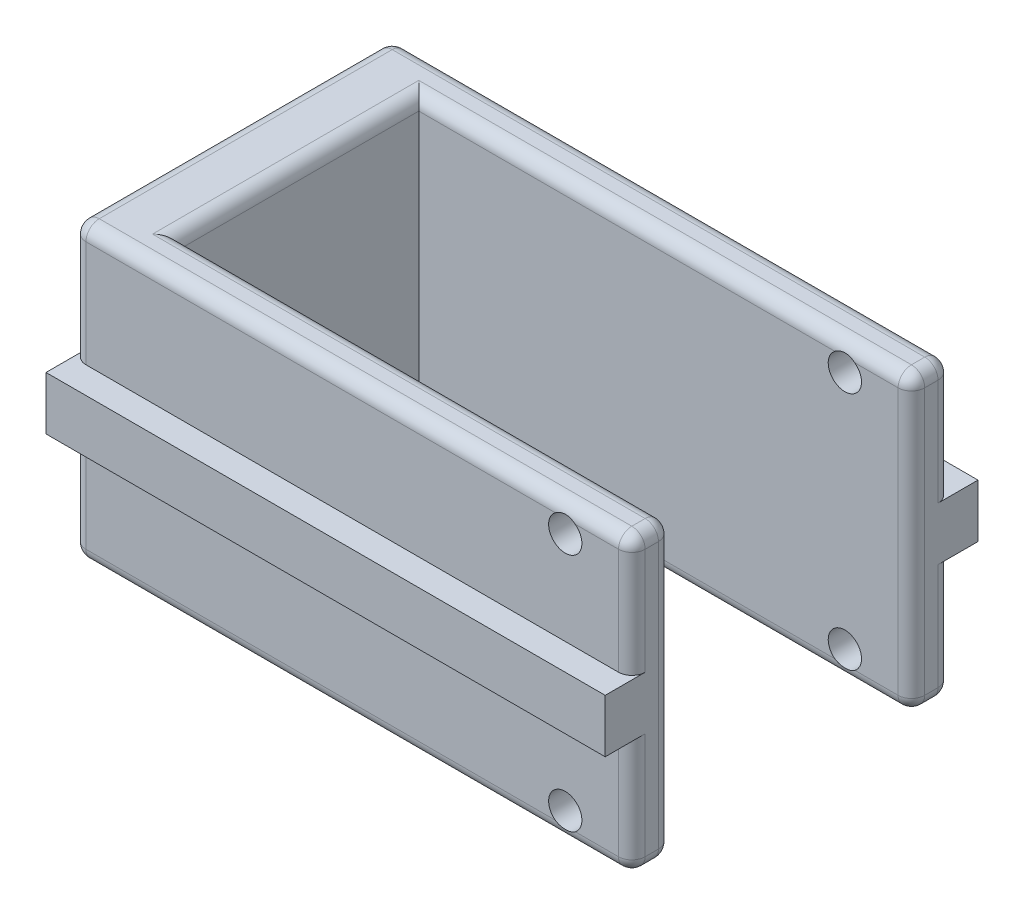
from build123d import *

# Parameters (mm, degrees)
BOSS_EXTRUDE1_DEPTH = 22
SKETCH2_R           = 1.25
CUT_EXTRUDE1_DEPTH  = 54.141321022
SKETCH3_R           = 2.5
BOSS_EXTRUDE2_DEPTH = 5
FILLET1_R           = 1
SKETCH4_W           = 4
SKETCH4_H           = 4
BOSS_EXTRUDE3_DEPTH = 42
FILLET2_R           = 1
FILLET3_R           = 1
FILLET4_R           = 1
FILLET5_R           = 1


with BuildPart() as part:
    # Sketch1 → Boss-Extrude1 (new body)
    with BuildSketch(Plane(origin=(0, 0, 0), x_dir=(1, 0, 0), z_dir=(0, 1, 0))):
        Polygon((0, 0), (-42, 0), (-42, 24), (0, 24), (0, 21), (-37, 21), (-37, 3), (0, 3), align=None)
    extrude(amount=BOSS_EXTRUDE1_DEPTH)

    # Sketch2 → Cut-Extrude1 (cut, through all)
    with BuildSketch(Plane.XY):
        with Locations((-5, 20)):
            Circle(SKETCH2_R)
        with Locations((-5, 2)):
            Circle(SKETCH2_R)
    extrude(amount=-CUT_EXTRUDE1_DEPTH, mode=Mode.SUBTRACT)

    # Sketch3 → Boss-Extrude2 (add)
    with BuildSketch(Plane.ZY.offset(42)):
        with Locations((-12, 11)):
            Circle(SKETCH3_R)
    extrude(amount=BOSS_EXTRUDE2_DEPTH)

    # Fillet1
    fillet1_edges = [part.edges().sort_by_distance(p)[0] for p in [
        (-42, 11, -14.5),
    ]]
    fillet(fillet1_edges, radius=FILLET1_R)

    # Sketch4 → Boss-Extrude3 (add)
    with BuildSketch(Plane.ZY.offset(42)):
        with Locations((-24, 11)):
            Rectangle(SKETCH4_W, SKETCH4_H)
        with Locations((0, 11)):
            Rectangle(SKETCH4_W, SKETCH4_H)
    extrude(amount=-BOSS_EXTRUDE3_DEPTH)

    # Fillet2
    fillet2_edges = [part.edges().sort_by_distance(p)[0] for p in [
        (-42, 22, -12),
        (-42, 0, -12),
    ]]
    fillet(fillet2_edges, radius=FILLET2_R)

    # Fillet3
    # the kernel refuses this fillet: 1 mm, written as the material it takes off along each edge
    with BuildSketch(Plane(origin=(-37, 22, -21), x_dir=(-1, 0, 0), z_dir=(0, 0, 1))) as fillet3_piece_1:
        with BuildLine():
            CenterArc((FILLET3_R, FILLET3_R), FILLET3_R, 180, 90)
            Line((0, FILLET3_R), (0, 0))
            Line((0, 0), (FILLET3_R, 0))
        make_face()
    extrude(amount=18, mode=Mode.SUBTRACT)
    with BuildSketch(Plane(origin=(2.5, 22, -21), x_dir=(0, 0, -1), z_dir=(-1, 0, 0)), Plane(origin=(-37, 22, -3), x_dir=(0, 0, 1), z_dir=(1, 0, 0))) as fillet3_piece_2:
        with BuildLine():
            CenterArc((FILLET3_R, FILLET3_R), FILLET3_R, 180, 90)
            Line((0, FILLET3_R), (0, 0))
            Line((0, 0), (FILLET3_R, 0))
        make_face()
    extrude(amount=39.5, mode=Mode.SUBTRACT)
    with BuildSketch(Plane(origin=(0, 22, -26.5), x_dir=(0, -1, 0), z_dir=(0, 0, 1)), Plane(origin=(0, 22, -5.5), x_dir=(0, -1, 0), z_dir=(0, 0, 1)), Plane(origin=(-42, 13, 0), x_dir=(0, 0, -1), z_dir=(0, 1, 0))) as fillet3_piece_3:
        with BuildLine():
            CenterArc((FILLET3_R, -FILLET3_R), FILLET3_R, 90, 90)
            Line((0, -FILLET3_R), (0, 0))
            Line((0, 0), (FILLET3_R, 0))
        make_face()
    extrude(amount=8, mode=Mode.SUBTRACT)
    with BuildSketch(Plane(origin=(-41, 22, -24), x_dir=(0, -1, 0), z_dir=(1, 0, 0)), Plane(origin=(2.5, 22, 0), x_dir=(0, -1, 0), z_dir=(-1, 0, 0))) as fillet3_piece_4:
        with BuildLine():
            CenterArc((FILLET3_R, -FILLET3_R), FILLET3_R, 90, 90)
            Line((0, -FILLET3_R), (0, 0))
            Line((0, 0), (FILLET3_R, 0))
        make_face()
    extrude(amount=43.5, mode=Mode.SUBTRACT)
    with BuildSketch(Plane(origin=(-42, 13, -24), x_dir=(0, 0, 1), z_dir=(0, 1, 0))) as fillet3_piece_5:
        with BuildLine():
            CenterArc((FILLET3_R, FILLET3_R), FILLET3_R, 180, 90)
            Line((0, FILLET3_R), (0, 0))
            Line((0, 0), (FILLET3_R, 0))
        make_face()
    extrude(amount=8, mode=Mode.SUBTRACT)
    with BuildSketch(Plane(origin=(-41, 21, 0), x_dir=(-1, 0, 0), z_dir=(0, -1, 0))) as fillet3_piece_6:
        with BuildLine():
            CenterArc((1 - FILLET3_R, FILLET3_R), FILLET3_R, 270, 90)
            Line((1, FILLET3_R), (1, 0))
            Line((1, 0), (1 - FILLET3_R, 0))
        make_face()
    revolve(axis=Axis((-41, 21, 0), (0, 0, -1)), revolution_arc=90, mode=Mode.SUBTRACT)
    with BuildSketch(Plane(origin=(-41, 21, -24), x_dir=(-1, 0, 0), z_dir=(0, -1, 0))) as fillet3_piece_7:
        with BuildLine():
            CenterArc((1 - FILLET3_R, -FILLET3_R), FILLET3_R, 0, 90)
            Line((1 - FILLET3_R, 0), (1, 0))
            Line((1, 0), (1, -FILLET3_R))
        make_face()
    revolve(axis=Axis((-41, 21, -24), (0, 0, -1)), revolution_arc=90, mode=Mode.SUBTRACT)
    with BuildSketch(Plane(origin=(-37, 22, -23.5), x_dir=(-1, 0, 0), z_dir=(0, 0, 1))) as fillet3_piece_8a_section:
        with BuildLine():
            CenterArc((FILLET3_R, FILLET3_R), FILLET3_R, 180, 90)
            Line((0, FILLET3_R), (0, 0))
            Line((0, 0), (FILLET3_R, 0))
        make_face()
    fillet3_piece_8a = extrude(amount=20.5, mode=Mode.PRIVATE)
    fillet3_piece_8a = split(fillet3_piece_8a, bisect_by=Plane(origin=(-37.226395114, 21.773604886, -21), z_dir=(0, 0, -1)), keep=Keep.TOP, mode=Mode.PRIVATE)
    with BuildSketch(Plane(origin=(2.5, 22, -21), x_dir=(0, 0, -1), z_dir=(-1, 0, 0))) as fillet3_piece_8b_section:
        with BuildLine():
            CenterArc((FILLET3_R, FILLET3_R), FILLET3_R, 180, 90)
            Line((0, FILLET3_R), (0, 0))
            Line((0, 0), (FILLET3_R, 0))
        make_face()
    fillet3_piece_8b = extrude(amount=42, mode=Mode.PRIVATE)
    fillet3_piece_8b = split(fillet3_piece_8b, bisect_by=Plane(origin=(-37, 21.773604886, -21.226395114), z_dir=(-1, 0, 0)), keep=Keep.TOP, mode=Mode.PRIVATE)
    fillet3_piece_8 = fillet3_piece_8a & fillet3_piece_8b
    add(fillet3_piece_8, mode=Mode.SUBTRACT)
    with BuildSketch(Plane(origin=(-39.5, 22, -3), x_dir=(0, 0, 1), z_dir=(1, 0, 0))) as fillet3_piece_9a_section:
        with BuildLine():
            CenterArc((FILLET3_R, FILLET3_R), FILLET3_R, 180, 90)
            Line((0, FILLET3_R), (0, 0))
            Line((0, 0), (FILLET3_R, 0))
        make_face()
    fillet3_piece_9a = extrude(amount=42, mode=Mode.PRIVATE)
    fillet3_piece_9a = split(fillet3_piece_9a, bisect_by=Plane(origin=(-37, 21.773604886, -2.773604886), z_dir=(-1, 0, 0)), keep=Keep.TOP, mode=Mode.PRIVATE)
    with BuildSketch(Plane(origin=(-37, 22, -21), x_dir=(-1, 0, 0), z_dir=(0, 0, 1))) as fillet3_piece_9b_section:
        with BuildLine():
            CenterArc((FILLET3_R, FILLET3_R), FILLET3_R, 180, 90)
            Line((0, FILLET3_R), (0, 0))
            Line((0, 0), (FILLET3_R, 0))
        make_face()
    fillet3_piece_9b = extrude(amount=20.5, mode=Mode.PRIVATE)
    fillet3_piece_9b = split(fillet3_piece_9b, bisect_by=Plane(origin=(-37.226395114, 21.773604886, -3), z_dir=(0, 0, 1)), keep=Keep.TOP, mode=Mode.PRIVATE)
    fillet3_piece_9 = fillet3_piece_9a & fillet3_piece_9b
    add(fillet3_piece_9, mode=Mode.SUBTRACT)

    # Fillet4
    # the kernel refuses this fillet: 1 mm, written as the material it takes off along each edge
    with BuildSketch(Plane(origin=(-37, 0, -3), x_dir=(0, 1, 0), z_dir=(1, 0, 0)), Plane(origin=(2.5, 0, -21), x_dir=(0, 1, 0), z_dir=(-1, 0, 0))) as fillet4_piece_1:
        with BuildLine():
            CenterArc((FILLET4_R, FILLET4_R), FILLET4_R, 180, 90)
            Line((0, FILLET4_R), (0, 0))
            Line((0, 0), (FILLET4_R, 0))
        make_face()
    extrude(amount=39.5, mode=Mode.SUBTRACT)
    with BuildSketch(Plane(origin=(0, 0, -5.5), x_dir=(0, 1, 0), z_dir=(0, 0, 1)), Plane(origin=(-42, 1, -24), x_dir=(0, 0, 1), z_dir=(0, 1, 0)), Plane(origin=(0, 0, -26.5), x_dir=(0, 1, 0), z_dir=(0, 0, 1))) as fillet4_piece_2:
        with BuildLine():
            CenterArc((FILLET4_R, FILLET4_R), FILLET4_R, 180, 90)
            Line((0, FILLET4_R), (0, 0))
            Line((0, 0), (FILLET4_R, 0))
        make_face()
    extrude(amount=8, mode=Mode.SUBTRACT)
    with BuildSketch(Plane(origin=(-42, 1, 0), x_dir=(0, 0, -1), z_dir=(0, 1, 0))) as fillet4_piece_3:
        with BuildLine():
            CenterArc((FILLET4_R, -FILLET4_R), FILLET4_R, 90, 90)
            Line((0, -FILLET4_R), (0, 0))
            Line((0, 0), (FILLET4_R, 0))
        make_face()
    extrude(amount=8, mode=Mode.SUBTRACT)
    with BuildSketch(Plane(origin=(-41, 0, -24), x_dir=(0, 1, 0), z_dir=(1, 0, 0))) as fillet4_piece_4:
        with BuildLine():
            CenterArc((FILLET4_R, FILLET4_R), FILLET4_R, 180, 90)
            Line((0, FILLET4_R), (0, 0))
            Line((0, 0), (FILLET4_R, 0))
        make_face()
    extrude(amount=43.5, mode=Mode.SUBTRACT)
    with BuildSketch(Plane(origin=(2.5, 0, 0), x_dir=(0, 0, -1), z_dir=(-1, 0, 0))) as fillet4_piece_5:
        with BuildLine():
            CenterArc((FILLET4_R, -FILLET4_R), FILLET4_R, 90, 90)
            Line((0, -FILLET4_R), (0, 0))
            Line((0, 0), (FILLET4_R, 0))
        make_face()
    extrude(amount=43.5, mode=Mode.SUBTRACT)
    with BuildSketch(Plane(origin=(-41, 1, 0), x_dir=(-1, 0, 0), z_dir=(0, 1, 0))) as fillet4_piece_6:
        with BuildLine():
            CenterArc((1 - FILLET4_R, -FILLET4_R), FILLET4_R, 360, 90)
            Line((1, -FILLET4_R), (1, 0))
            Line((1, 0), (1 - FILLET4_R, 0))
        make_face()
    revolve(axis=Axis((-41, 1, 0), (0, 0, 1)), revolution_arc=90, mode=Mode.SUBTRACT)
    with BuildSketch(Plane(origin=(-41, 1, -24), x_dir=(-1, 0, 0), z_dir=(0, 1, 0))) as fillet4_piece_7:
        with BuildLine():
            CenterArc((1 - FILLET4_R, FILLET4_R), FILLET4_R, 270, 90)
            Line((1, FILLET4_R), (1, 0))
            Line((1, 0), (1 - FILLET4_R, 0))
        make_face()
    revolve(axis=Axis((-41, 1, -24), (0, 0, 1)), revolution_arc=90, mode=Mode.SUBTRACT)
    with BuildSketch(Plane(origin=(-37, 0, -21), x_dir=(0, 1, 0), z_dir=(0, 0, 1))) as fillet4_piece_8:
        with BuildLine():
            CenterArc((FILLET4_R, FILLET4_R), FILLET4_R, 180, 90)
            Line((0, FILLET4_R), (0, 0))
            Line((0, 0), (FILLET4_R, 0))
        make_face()
    extrude(amount=18, mode=Mode.SUBTRACT)
    with BuildSketch(Plane(origin=(-39.5, 0, -3), x_dir=(0, 1, 0), z_dir=(1, 0, 0))) as fillet4_piece_9a_section:
        with BuildLine():
            CenterArc((FILLET4_R, FILLET4_R), FILLET4_R, 180, 90)
            Line((0, FILLET4_R), (0, 0))
            Line((0, 0), (FILLET4_R, 0))
        make_face()
    fillet4_piece_9a = extrude(amount=42, mode=Mode.PRIVATE)
    fillet4_piece_9a = split(fillet4_piece_9a, bisect_by=Plane(origin=(-37, 0.226395114, -2.773604886), z_dir=(-1, 0, 0)), keep=Keep.TOP, mode=Mode.PRIVATE)
    with BuildSketch(Plane(origin=(-37, 0, -21), x_dir=(0, 1, 0), z_dir=(0, 0, 1))) as fillet4_piece_9b_section:
        with BuildLine():
            CenterArc((FILLET4_R, FILLET4_R), FILLET4_R, 180, 90)
            Line((0, FILLET4_R), (0, 0))
            Line((0, 0), (FILLET4_R, 0))
        make_face()
    fillet4_piece_9b = extrude(amount=20.5, mode=Mode.PRIVATE)
    fillet4_piece_9b = split(fillet4_piece_9b, bisect_by=Plane(origin=(-37.226395114, 0.226395114, -3), z_dir=(0, 0, 1)), keep=Keep.TOP, mode=Mode.PRIVATE)
    fillet4_piece_9 = fillet4_piece_9a & fillet4_piece_9b
    add(fillet4_piece_9, mode=Mode.SUBTRACT)
    with BuildSketch(Plane(origin=(2.5, 0, -21), x_dir=(0, 1, 0), z_dir=(-1, 0, 0))) as fillet4_piece_10a_section:
        with BuildLine():
            CenterArc((FILLET4_R, FILLET4_R), FILLET4_R, 180, 90)
            Line((0, FILLET4_R), (0, 0))
            Line((0, 0), (FILLET4_R, 0))
        make_face()
    fillet4_piece_10a = extrude(amount=42, mode=Mode.PRIVATE)
    fillet4_piece_10a = split(fillet4_piece_10a, bisect_by=Plane(origin=(-37, 0.226395114, -21.226395114), z_dir=(-1, 0, 0)), keep=Keep.TOP, mode=Mode.PRIVATE)
    with BuildSketch(Plane(origin=(-37, 0, -23.5), x_dir=(0, 1, 0), z_dir=(0, 0, 1))) as fillet4_piece_10b_section:
        with BuildLine():
            CenterArc((FILLET4_R, FILLET4_R), FILLET4_R, 180, 90)
            Line((0, FILLET4_R), (0, 0))
            Line((0, 0), (FILLET4_R, 0))
        make_face()
    fillet4_piece_10b = extrude(amount=20.5, mode=Mode.PRIVATE)
    fillet4_piece_10b = split(fillet4_piece_10b, bisect_by=Plane(origin=(-37.226395114, 0.226395114, -21), z_dir=(0, 0, -1)), keep=Keep.TOP, mode=Mode.PRIVATE)
    fillet4_piece_10 = fillet4_piece_10a & fillet4_piece_10b
    add(fillet4_piece_10, mode=Mode.SUBTRACT)

    # Fillet5
    # the kernel refuses this fillet: 1 mm, written as the material it takes off along each edge
    with BuildSketch(Plane(origin=(-1, 21, -23), x_dir=(1, 0, 0), z_dir=(0, 0, -1))) as fillet5_piece_1_section:
        Polygon((0, 0), (FILLET5_R, 0), (FILLET5_R, -FILLET5_R), (0, -FILLET5_R), align=None)
    fillet5_piece_1 = extrude(amount=FILLET5_R, mode=Mode.PRIVATE)
    fillet5_piece_1 = fillet5_piece_1 - Plane(origin=(-1, 21, -23), x_dir=(-0.7071067811865475, -0.7071067811865475, 0), z_dir=(0, 0, -1)) * Sphere(FILLET5_R, mode=Mode.PRIVATE)
    add(fillet5_piece_1, mode=Mode.SUBTRACT)
    with BuildSketch(Plane(origin=(-1, 21, -22), x_dir=(0, 0, 1), z_dir=(1, 0, 0))) as fillet5_piece_2_section:
        Polygon((0, 0), (FILLET5_R, 0), (FILLET5_R, -FILLET5_R), (0, -FILLET5_R), align=None)
    fillet5_piece_2 = extrude(amount=FILLET5_R, mode=Mode.PRIVATE)
    fillet5_piece_2 = fillet5_piece_2 - Plane(origin=(-1, 21, -22), x_dir=(0, -0.7071067811865475, -0.7071067811865475), z_dir=(1, 0, 0)) * Sphere(FILLET5_R, mode=Mode.PRIVATE)
    add(fillet5_piece_2, mode=Mode.SUBTRACT)
    with BuildSketch(Plane(origin=(-1, 21, -2), x_dir=(0, 0, -1), z_dir=(1, 0, 0))) as fillet5_piece_3_section:
        Polygon((0, 0), (FILLET5_R, 0), (FILLET5_R, FILLET5_R), (0, FILLET5_R), align=None)
    fillet5_piece_3 = extrude(amount=FILLET5_R, mode=Mode.PRIVATE)
    fillet5_piece_3 = fillet5_piece_3 - Plane(origin=(-1, 21, -2), x_dir=(0, -0.7071067811865475, 0.7071067811865475), z_dir=(1, 0, 0)) * Sphere(FILLET5_R, mode=Mode.PRIVATE)
    add(fillet5_piece_3, mode=Mode.SUBTRACT)
    with BuildSketch(Plane(origin=(-1, 21, -1), x_dir=(0, 0, 1), z_dir=(1, 0, 0))) as fillet5_piece_4_section:
        Polygon((0, 0), (FILLET5_R, 0), (FILLET5_R, -FILLET5_R), (0, -FILLET5_R), align=None)
    fillet5_piece_4 = extrude(amount=FILLET5_R, mode=Mode.PRIVATE)
    fillet5_piece_4 = fillet5_piece_4 - Plane(origin=(-1, 21, -1), x_dir=(0, -0.7071067811865475, -0.7071067811865475), z_dir=(1, 0, 0)) * Sphere(FILLET5_R, mode=Mode.PRIVATE)
    add(fillet5_piece_4, mode=Mode.SUBTRACT)
    with BuildSketch(Plane(origin=(-1, 1, -1), x_dir=(0, 0, 1), z_dir=(1, 0, 0))) as fillet5_piece_5_section:
        Polygon((0, 0), (FILLET5_R, 0), (FILLET5_R, FILLET5_R), (0, FILLET5_R), align=None)
    fillet5_piece_5 = extrude(amount=FILLET5_R, mode=Mode.PRIVATE)
    fillet5_piece_5 = fillet5_piece_5 - Plane(origin=(-1, 1, -1), x_dir=(0, 0.7071067811865475, -0.7071067811865475), z_dir=(1, 0, 0)) * Sphere(FILLET5_R, mode=Mode.PRIVATE)
    add(fillet5_piece_5, mode=Mode.SUBTRACT)
    with BuildSketch(Plane(origin=(-1, 1, -2), x_dir=(0, 0, -1), z_dir=(1, 0, 0))) as fillet5_piece_6_section:
        Polygon((0, 0), (FILLET5_R, 0), (FILLET5_R, -FILLET5_R), (0, -FILLET5_R), align=None)
    fillet5_piece_6 = extrude(amount=FILLET5_R, mode=Mode.PRIVATE)
    fillet5_piece_6 = fillet5_piece_6 - Plane(origin=(-1, 1, -2), x_dir=(0, 0.7071067811865475, 0.7071067811865475), z_dir=(1, 0, 0)) * Sphere(FILLET5_R, mode=Mode.PRIVATE)
    add(fillet5_piece_6, mode=Mode.SUBTRACT)
    with BuildSketch(Plane(origin=(-1, 1, -22), x_dir=(0, 0, 1), z_dir=(1, 0, 0))) as fillet5_piece_7_section:
        Polygon((0, 0), (FILLET5_R, 0), (FILLET5_R, FILLET5_R), (0, FILLET5_R), align=None)
    fillet5_piece_7 = extrude(amount=FILLET5_R, mode=Mode.PRIVATE)
    fillet5_piece_7 = fillet5_piece_7 - Plane(origin=(-1, 1, -22), x_dir=(0, 0.7071067811865475, -0.7071067811865475), z_dir=(1, 0, 0)) * Sphere(FILLET5_R, mode=Mode.PRIVATE)
    add(fillet5_piece_7, mode=Mode.SUBTRACT)
    with BuildSketch(Plane(origin=(-1, 1, -23), x_dir=(1, 0, 0), z_dir=(0, 0, -1))) as fillet5_piece_8_section:
        Polygon((0, 0), (FILLET5_R, 0), (FILLET5_R, FILLET5_R), (0, FILLET5_R), align=None)
    fillet5_piece_8 = extrude(amount=FILLET5_R, mode=Mode.PRIVATE)
    fillet5_piece_8 = fillet5_piece_8 - Plane(origin=(-1, 1, -23), x_dir=(-0.7071067811865475, 0.7071067811865475, 0), z_dir=(0, 0, -1)) * Sphere(FILLET5_R, mode=Mode.PRIVATE)
    add(fillet5_piece_8, mode=Mode.SUBTRACT)
    with BuildSketch(Plane(origin=(0, 13, 0), x_dir=(0, 0, -1), z_dir=(0, 1, 0)), Plane(origin=(0, 13, -24), x_dir=(-1, 0, 0), z_dir=(0, 1, 0)), Plane(origin=(0, 1, -24), x_dir=(-1, 0, 0), z_dir=(0, 1, 0)), Plane(origin=(0, 1, 0), x_dir=(0, 0, -1), z_dir=(0, 1, 0))) as fillet5_piece_9:
        with BuildLine():
            CenterArc((FILLET5_R, FILLET5_R), FILLET5_R, 180, 90)
            Line((0, FILLET5_R), (0, 0))
            Line((0, 0), (FILLET5_R, 0))
        make_face()
    extrude(amount=8, mode=Mode.SUBTRACT)
    with BuildSketch(Plane(origin=(0, 1, -21), x_dir=(0, 0, -1), z_dir=(0, 1, 0))) as fillet5_piece_10:
        with BuildLine():
            CenterArc((FILLET5_R, FILLET5_R), FILLET5_R, 180, 90)
            Line((0, FILLET5_R), (0, 0))
            Line((0, 0), (FILLET5_R, 0))
        make_face()
    extrude(amount=20, mode=Mode.SUBTRACT)
    with BuildSketch(Plane(origin=(0, 1, -3), x_dir=(0, 0, 1), z_dir=(0, 1, 0))) as fillet5_piece_11:
        with BuildLine():
            CenterArc((FILLET5_R, -FILLET5_R), FILLET5_R, 90, 90)
            Line((0, -FILLET5_R), (0, 0))
            Line((0, 0), (FILLET5_R, 0))
        make_face()
    extrude(amount=20, mode=Mode.SUBTRACT)


solid = part.part
